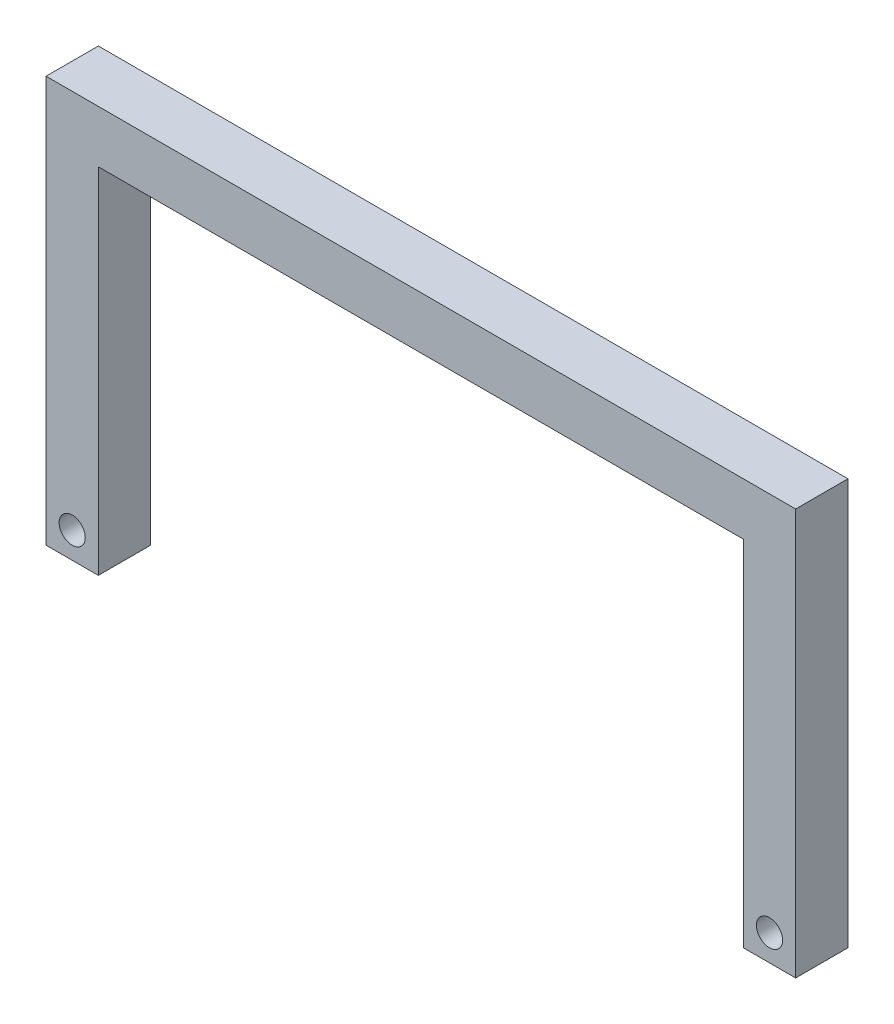
from build123d import *

# Parameters (mm, degrees)
SKETCH1_R           = 7.5
BOSS_EXTRUDE1_DEPTH = 15


with BuildPart() as part:
    # Sketch1 → Boss-Extrude1 (new, symmetric)
    with BuildSketch(Plane.XY):
        Polygon((-185, -218), (-185, -15), (185, -15), (185, -218), (215, -218), (215, -15), (215, 15), (-215, 15), (-215, -15), (-215, -218), align=None)
        with Locations((-200, -203)):
            Circle(SKETCH1_R, mode=Mode.SUBTRACT)
        with Locations((200, -203)):
            Circle(SKETCH1_R, mode=Mode.SUBTRACT)
    extrude(amount=BOSS_EXTRUDE1_DEPTH, both=True)


solid = part.part
